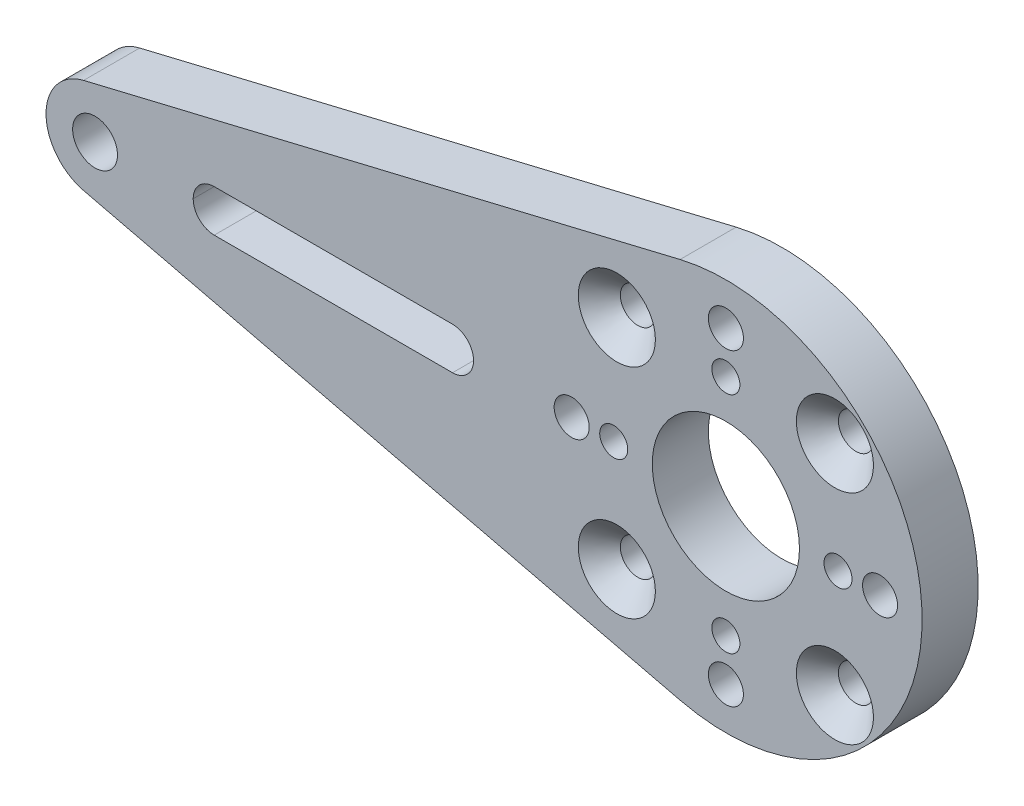
from build123d import *

# Parameters (mm, degrees)
SKETCH1_R           = 1.6
SKETCH1_R_2         = 5.25
BOSS_EXTRUDE1_DEPTH = 4
CUT_EXTRUDE1_REACH  = 52.638
SKETCH2_R           = 1
CIRPATTERN1_COUNT   = 4
CUT_EXTRUDE2_REACH  = 52.638
SKETCH3_R           = 1.25
CIRPATTERN2_COUNT   = 8
CHAMFER1_SIZE       = 1.5
CUT_EXTRUDE3_REACH  = 52.638
SKETCH4_W           = 20
SKETCH4_H           = 3
FILLET1_R           = 1.5


with BuildPart() as part:
    # Sketch1 → Boss-Extrude1 (new body)
    with BuildSketch(Plane.XY):
        with BuildLine():
            Line((-45.816666667, 3.403388834), (-3.266666667, 13.613555336))
            ThreePointArc((-3.266666667, 13.613555336), (14, 0), (-3.266666667, -13.613555336))
            Line((-3.266666667, -13.613555336), (-45.816666667, -3.403388834))
            ThreePointArc((-45.816666667, -3.403388834), (-48.5, 0), (-45.816666667, 3.403388834))
        make_face()
        with Locations((-45, 0)):
            Circle(SKETCH1_R, mode=Mode.SUBTRACT)
        Circle(SKETCH1_R_2, mode=Mode.SUBTRACT)
    extrude(amount=BOSS_EXTRUDE1_DEPTH)

    # Sketch2 → Cut-Extrude1 (cut, up to next)
    with BuildSketch(Plane.XY.offset(4), mode=Mode.PRIVATE) as cut_extrude1_sk1:
        with Locations((0, 8)):
            Circle(SKETCH2_R)
    cut_extrude1_tool1 = extrude(cut_extrude1_sk1.sketch, amount=-CUT_EXTRUDE1_REACH, mode=Mode.PRIVATE) & part.part
    cut_extrude1 = cut_extrude1_tool1.solids().sort_by_distance((0, 8, 4))[0]
    add(cut_extrude1, mode=Mode.SUBTRACT)

    # CirPattern1: Cut-Extrude1 ×4 about axis
    cirpattern1_axis = Axis((0, 0, 0), (0, 0, 1))
    for i in range(1, CIRPATTERN1_COUNT):
        add(cut_extrude1.rotate(cirpattern1_axis, i * 360 / CIRPATTERN1_COUNT), mode=Mode.SUBTRACT)

    # Sketch3 → Cut-Extrude2 (cut, up to next)
    with BuildSketch(Plane.XY.offset(4), mode=Mode.PRIVATE) as cut_extrude2_sk1:
        with Locations((0, 11)):
            Circle(SKETCH3_R)
    cut_extrude2_tool1 = extrude(cut_extrude2_sk1.sketch, amount=-CUT_EXTRUDE2_REACH, mode=Mode.PRIVATE) & part.part
    cut_extrude2 = cut_extrude2_tool1.solids().sort_by_distance((0, 11, 4))[0]
    add(cut_extrude2, mode=Mode.SUBTRACT)

    # CirPattern2: Cut-Extrude2 ×8 about axis
    cirpattern2_axis = Axis((0, 0, 0), (0, 0, 1))
    for i in range(1, CIRPATTERN2_COUNT):
        add(cut_extrude2.rotate(cirpattern2_axis, i * 360 / CIRPATTERN2_COUNT), mode=Mode.SUBTRACT)

    # Chamfer1
    chamfer1_edges = [part.edges().sort_by_distance(p)[0] for p in [
        (-6.894291117, -8.66205807, 4),
        (8.66205807, -6.894291117, 4),
        (6.894291117, 8.66205807, 4),
        (-8.66205807, 6.894291117, 4),
    ]]
    chamfer(chamfer1_edges, length=CHAMFER1_SIZE)

    # Sketch4 → Cut-Extrude3 (cut, up to next)
    with BuildSketch(Plane.XY.offset(4), mode=Mode.PRIVATE) as cut_extrude3_sk1:
        with Locations((-28, 0)):
            Rectangle(SKETCH4_W, SKETCH4_H)
    cut_extrude3_tool1 = extrude(cut_extrude3_sk1.sketch, amount=-CUT_EXTRUDE3_REACH, mode=Mode.PRIVATE) & part.part
    add(cut_extrude3_tool1.solids().sort_by_distance((-28, 0, 4))[0], mode=Mode.SUBTRACT)

    # Fillet1
    fillet1_edges = [part.edges().sort_by_distance(p)[0] for p in [
        (-18, -1.5, 2),
        (-18, 1.5, 2),
        (-38, 1.5, 2),
        (-38, -1.5, 2),
    ]]
    fillet(fillet1_edges, radius=FILLET1_R - 0.0001)  # a hair under: the kernel refuses the full size


solid = part.part
